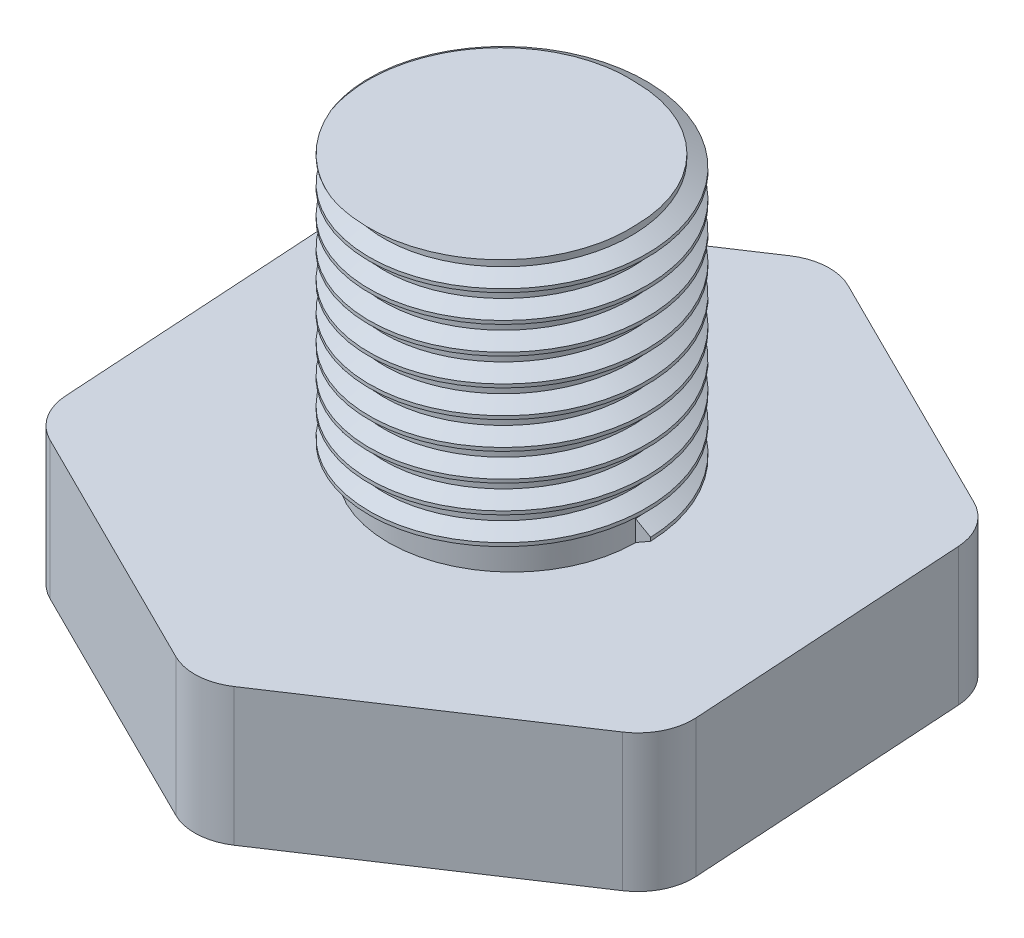
from build123d import *
from build123d.topology import SkipClean

# Parameters (mm, degrees)
SKETCH_1_R          = 12.5
EXTRUDE_1_DEPTH     = 5
SKETCH_2_R          = 4.5
EXTRUDE_2_DEPTH     = 10
THREAD_1_PITCH      = 1
SKETCH_7_R          = 11.114074925
CUT_EXTRUDE_1_DEPTH = 10
SKETCH_8_OUTSIDE_W  = 34.682
SKETCH_8_OUTSIDE_H  = 34.682
CUT_EXTRUDE_2_DEPTH = 10


with BuildPart() as part:
    # Sketch 1 → 凸台-拉伸1 (new body)
    with BuildSketch(Plane(origin=(0, 0, 0), x_dir=(1, 0, 0), z_dir=(0, 1, 0))):
        with Locations(Location((0, 0, 0), (0, 0, 270))):
            Circle(SKETCH_1_R)
    extrude(amount=EXTRUDE_1_DEPTH)

    # 草图2 → 凸台-拉伸2 (add)
    with BuildSketch(Plane(origin=(0, 5, 0), x_dir=(1, 0, 0), z_dir=(0, 1, 0))):
        with Locations(Location((0, 0, 0), (0, 0, 270))):
            Circle(SKETCH_2_R)
    extrude(amount=EXTRUDE_2_DEPTH)

    # 螺纹线1: the profile of Sketch 1 2 profile screwed along a right-hand helix of 10 turns, 8 arcs to a turn; built about Z, then put on its axis
    with SkipClean():  # the faces are left unmerged after this step: merging them gives an invalid solid
        thread_1_z = Axis((0, 0, 0), (0, 0, 1))
        thread_1_corners = [(4.4997, 0, -0.000173205), (5.041265875, 0, 0.312499999), (5.041265875, 0, 0.437499999), (4.4997, 0, 0.750173202)]
        with BuildLine(mode=Mode.PRIVATE) as thread_1_profile:
            Line(thread_1_corners[0], thread_1_corners[1])
            Line(thread_1_corners[1], thread_1_corners[2])
            Line(thread_1_corners[2], thread_1_corners[3])
            Line(thread_1_corners[3], thread_1_corners[0])
        thread_1_cap = Face(thread_1_profile.wire())
        thread_1_turn_angles = [0, 22.5, 45, 67.5, 90, 112.5, 135, 157.5, 180, 202.5, 225, 247.5, 270, 292.5, 315, 337.5, 360]
        thread_1_turn_weights = [1, 0.9238795325112867, 1, 0.9238795325112867, 1, 0.9238795325112867, 1, 0.9238795325112867, 1, 0.9238795325112867, 1, 0.9238795325112867, 1, 0.9238795325112867, 1, 0.9238795325112867, 1]
        thread_1_turn_rails = [Edge.make_bspline([Vector(p[0], p[1], 0).rotate(thread_1_z, thread_1_turn_angles[k]) / thread_1_turn_weights[k] + Vector(0, 0, p[2] + THREAD_1_PITCH * thread_1_turn_angles[k] / 360) for k in range(17)], [0, 0, 0, 1, 1, 2, 2, 3, 3, 4, 4, 5, 5, 6, 6, 7, 7, 8, 8, 8], 2, thread_1_turn_weights) for p in thread_1_corners]
        thread_1_turn_sides = [Face.make_surface_from_curves(thread_1_turn_rails[p[0]], thread_1_turn_rails[p[1]]) for p in [(0, 1), (1, 2), (2, 3), (3, 0)]]
        thread_1 = Plane(origin=(0, 5, 0), x_dir=(1, 0, 0), z_dir=(0, 1, 0)) * Solid(Shell([*[p.moved(Location((0, 0, THREAD_1_PITCH * i))) for i in range(10) for p in thread_1_turn_sides], thread_1_cap, thread_1_cap.rotate(thread_1_z, 3600).moved(Location((0, 0, THREAD_1_PITCH * 3600 / 360)))]))
        add(thread_1)

    # 草图7 → 切除-拉伸1 (cut)
    with SkipClean():  # the faces are left unmerged after this step: merging them gives an invalid solid
        with BuildSketch(Plane(origin=(0, 15, 0), x_dir=(1, 0, 0), z_dir=(0, 1, 0))):
            Circle(SKETCH_7_R)
        extrude(amount=CUT_EXTRUDE_1_DEPTH, mode=Mode.SUBTRACT)

    # 草图8 outside → 切除-拉伸2 (cut)
    with SkipClean():  # the faces are left unmerged after this step: merging them gives an invalid solid
        with BuildSketch(Plane.XZ):
            Rectangle(SKETCH_8_OUTSIDE_W, SKETCH_8_OUTSIDE_H)
            with BuildLine():
                Line((10.490584336, -5.753018068), (11.118863756, 4.418194809))
                ThreePointArc((11.118863756, 4.418194809), (10.913077141, 5.432812293), (10.227551963, 6.208603502))
                Line((10.227551963, 6.208603502), (1.733162934, 11.838315879))
                ThreePointArc((1.733162934, 11.838315879), (0.751585111, 12.167408185), (-0.263032373, 11.96162157))
                Line((-0.263032373, 11.96162157), (-9.385700822, 7.42012107))
                ThreePointArc((-9.385700822, 7.42012107), (-10.161492031, 6.734595891), (-10.490584336, 5.753018068))
                Line((-10.490584336, 5.753018068), (-11.118863756, -4.418194809))
                ThreePointArc((-11.118863756, -4.418194809), (-10.913077141, -5.432812293), (-10.227551963, -6.208603502))
                Line((-10.227551963, -6.208603502), (-1.733162934, -11.838315879))
                ThreePointArc((-1.733162934, -11.838315879), (-0.751585111, -12.167408185), (0.263032373, -11.96162157))
                Line((0.263032373, -11.96162157), (9.385700822, -7.42012107))
                ThreePointArc((9.385700822, -7.42012107), (10.161492031, -6.734595891), (10.490584336, -5.753018068))
            make_face(mode=Mode.SUBTRACT)
        extrude(amount=-CUT_EXTRUDE_2_DEPTH, mode=Mode.SUBTRACT)


solid = part.part
